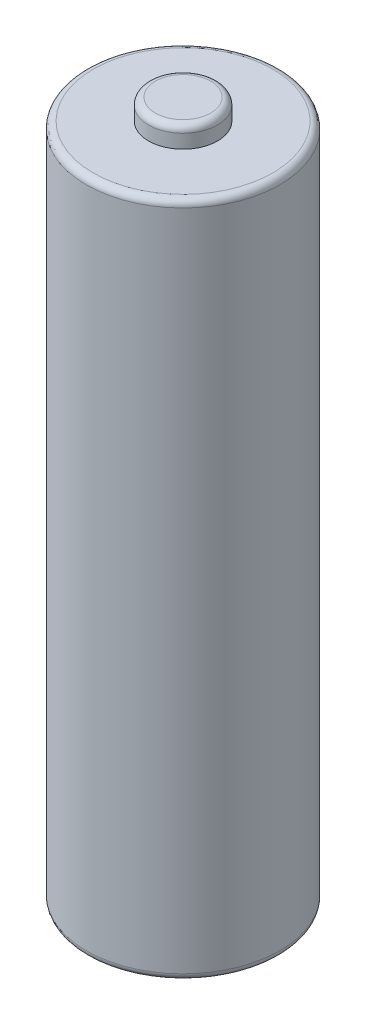
from build123d import *

# Parameters (mm, degrees)
SKETCH1_R           = 7
BOSS_EXTRUDE1_DEPTH = 49
SKETCH2_R           = 2.5
BOSS_EXTRUDE2_DEPTH = 1.5
FILLET1_R           = 0.5


with BuildPart() as part:
    # Sketch1 → Boss-Extrude1 (new body)
    with BuildSketch(Plane(origin=(0, 0, 0), x_dir=(1, 0, 0), z_dir=(0, 1, 0))):
        Circle(SKETCH1_R)
    extrude(amount=BOSS_EXTRUDE1_DEPTH)

    # Sketch2 → Boss-Extrude2 (add)
    with BuildSketch(Plane(origin=(0, 49, 0), x_dir=(1, 0, 0), z_dir=(0, 1, 0))):
        Circle(SKETCH2_R)
    extrude(amount=BOSS_EXTRUDE2_DEPTH)

    # Fillet1
    fillet1_edges = [part.edges().sort_by_distance(p)[0] for p in [
        (-7, 0, 0),
        (-2.5, 50.5, 0),
        (-7, 49, 0),
    ]]
    fillet(fillet1_edges, radius=FILLET1_R)


solid = part.part
